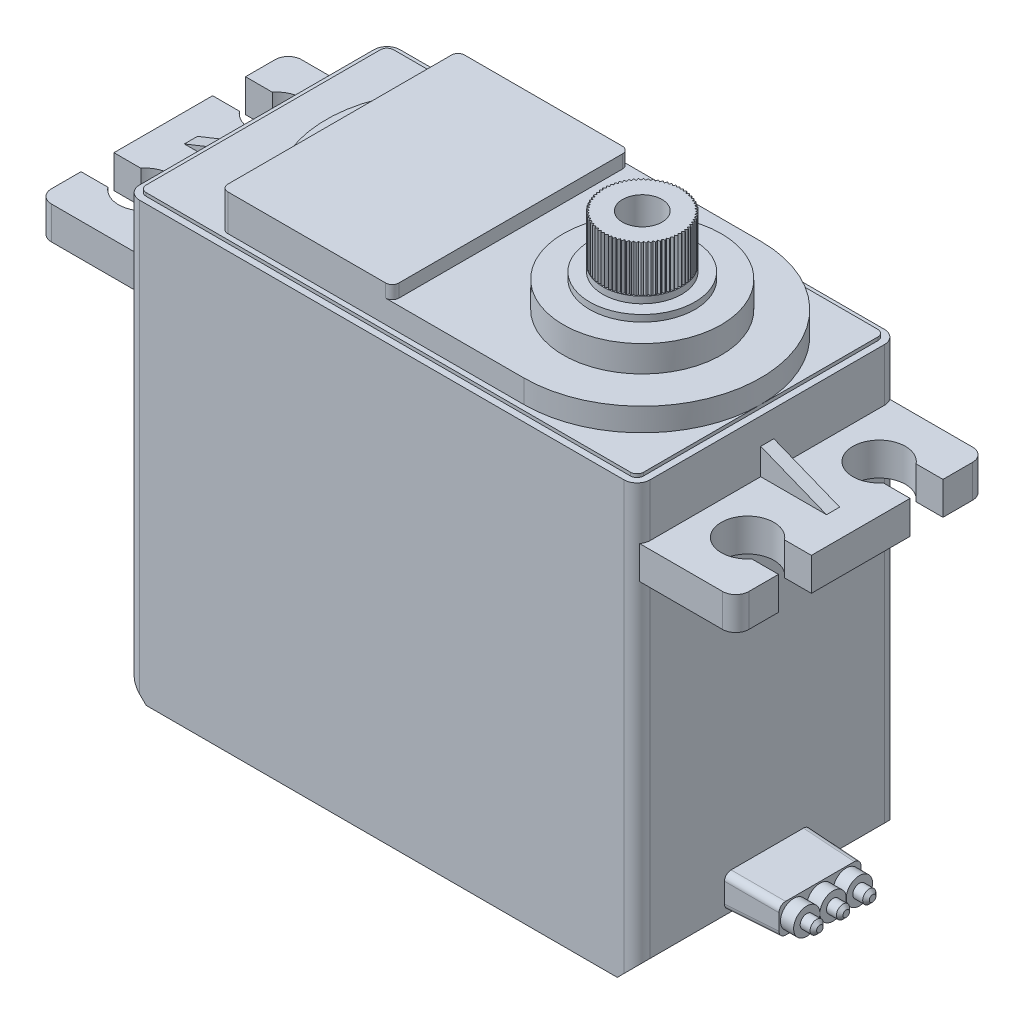
from build123d import *

# Parameters (mm, degrees)
SKETCH1_W          = 38.8
SKETCH1_H          = 19.8
EXTRUDE1_DEPTH     = 26.5
CHAMFER1_SIZE      = 1.5
EXTRUDE5_DEPTH     = 2.5
SKETCH3_W          = 38.8
SKETCH3_H          = 19.8
EXTRUDE6_DEPTH     = 4
FILLET1_R          = 1
EXTRUDE8_DEPTH     = 2
EXTRUDE9_DEPTH     = 1
EXTRUDE10_DEPTH    = 2.5
EXTRUDE11_DEPTH    = 0.25
SKETCH9_R          = 6
EXTRUDE12_DEPTH    = 2
SKETCH10_R         = 4
EXTRUDE13_DEPTH    = 0.5
SKETCH11_R         = 3
EXTRUDE14_DEPTH    = 4
SKETCH22_R         = 1
SKETCH22_R_2       = 0.5
EXTRUDE25_DEPTH    = 5
EXTRUDE25_2_DEPTH  = 5
EXTRUDE25_3_DEPTH  = 5
SKETCH24_R         = 0.5
EXTRUDE26_DEPTH    = 6
CHAMFER2_SIZE      = 0.25
SKETCH25_W         = 6.5
SKETCH25_H         = 2.5
EXTRUDE27_DEPTH    = 4
EXTRUDE27_TAPER    = 2
FILLET8_R          = 0.5
RIB2_REACH         = 52.225
SKETCH28_WALL_W    = 107.834355944
SKETCH28_WALL_H    = 1
CUT_EXTRUDE1_DEPTH = 3.5


with BuildPart() as part:
    # Sketch1 → Extrude1 (new body)
    with BuildSketch(Plane(origin=(0, 0, 0), x_dir=(1, 0, 0), z_dir=(0, 1, 0))):
        Rectangle(SKETCH1_W, SKETCH1_H)
    extrude(amount=EXTRUDE1_DEPTH)

    # Chamfer1
    chamfer1_edges = [part.edges().sort_by_distance(p)[0] for p in [
        (19.4, 0, 0),
        (-19.4, 0, 0),
    ]]
    chamfer(chamfer1_edges, length=CHAMFER1_SIZE)

    # Sketch2 → Extrude5 (add)
    with BuildSketch(Plane(origin=(0, 26.5, 0), x_dir=(-1, 0, 0), z_dir=(0, 1, 0))):
        with BuildLine():
            Line((19.4, -9.9), (-19.4, -9.9))
            Line((-19.4, -9.9), (-19.4, -9.5))
            Line((-19.4, -9.5), (-25.5, -9.5))
            ThreePointArc((-25.5, -9.5), (-26.207106781, -9.207106781), (-26.5, -8.5))
            Line((-26.5, -8.5), (-26.5, -6.25))
            Line((-26.5, -6.25), (-24.4612495, -6.25))
            ThreePointArc((-24.4612495, -6.25), (-20.9, -5), (-24.4612495, -3.75))
            Line((-24.4612495, -3.75), (-26.5, -3.75))
            Line((-26.5, -3.75), (-26.5, 3.75))
            Line((-26.5, 3.75), (-24.4612495, 3.75))
            ThreePointArc((-24.4612495, 3.75), (-20.9, 5), (-24.4612495, 6.25))
            Line((-24.4612495, 6.25), (-26.5, 6.25))
            Line((-26.5, 6.25), (-26.5, 8.5))
            ThreePointArc((-26.5, 8.5), (-26.207106781, 9.207106781), (-25.5, 9.5))
            Line((-25.5, 9.5), (-19.4, 9.5))
            Line((-19.4, 9.5), (-19.4, 9.9))
            Line((-19.4, 9.9), (19.4, 9.9))
            Line((19.4, 9.9), (19.4, 9.5))
            Line((19.4, 9.5), (25.5, 9.5))
            ThreePointArc((25.5, 9.5), (26.207106781, 9.207106781), (26.5, 8.5))
            Line((26.5, 8.5), (26.5, 6.25))
            Line((26.5, 6.25), (24.4612495, 6.25))
            ThreePointArc((24.4612495, 6.25), (20.9, 5), (24.4612495, 3.75))
            Line((24.4612495, 3.75), (26.5, 3.75))
            Line((26.5, 3.75), (26.5, -3.75))
            Line((26.5, -3.75), (24.4612495, -3.75))
            ThreePointArc((24.4612495, -3.75), (20.9, -5), (24.4612495, -6.25))
            Line((24.4612495, -6.25), (26.5, -6.25))
            Line((26.5, -6.25), (26.5, -8.5))
            ThreePointArc((26.5, -8.5), (26.207106781, -9.207106781), (25.5, -9.5))
            Line((25.5, -9.5), (19.4, -9.5))
            Line((19.4, -9.5), (19.4, -9.9))
        make_face()
    extrude(amount=EXTRUDE5_DEPTH)

    # Sketch3 → Extrude6 (add)
    with BuildSketch(Plane(origin=(0, 29, 0), x_dir=(-1, 0, 0), z_dir=(0, 1, 0))):
        Rectangle(SKETCH3_W, SKETCH3_H)
    extrude(amount=EXTRUDE6_DEPTH)

    # Fillet1
    # the kernel refuses this fillet: 1 mm, written as the material it takes off along each edge
    with BuildSketch(Plane(origin=(-19.4, 35.5, -9.9), x_dir=(0, 0, 1), z_dir=(0, -1, 0))) as fillet1_piece_1_section:
        with BuildLine():
            CenterArc((FILLET1_R, -FILLET1_R), FILLET1_R, 90, 90)
            Line((0, -FILLET1_R), (0, 0))
            Line((0, 0), (FILLET1_R, 0))
        make_face()
    fillet1_piece_1 = extrude(amount=36.5, mode=Mode.PRIVATE)
    fillet1_piece_1 = split(fillet1_piece_1, bisect_by=Plane(origin=(-19.357622506, 32.25, -9.5), z_dir=(0, 0, 1)), keep=Keep.TOP, mode=Mode.PRIVATE)
    fillet1_piece_1 = split(fillet1_piece_1, bisect_by=Plane(origin=(-19.357622506, 29, -9.316588344), z_dir=(0, 1, 0)), keep=Keep.TOP, mode=Mode.PRIVATE)
    add(fillet1_piece_1, mode=Mode.SUBTRACT)
    with BuildSketch(Plane(origin=(-19.4, 35.5, -9.9), x_dir=(0, 0, 1), z_dir=(0, -1, 0))) as fillet1_piece_2_section:
        with BuildLine():
            CenterArc((FILLET1_R, -FILLET1_R), FILLET1_R, 90, 90)
            Line((0, -FILLET1_R), (0, 0))
            Line((0, 0), (FILLET1_R, 0))
        make_face()
    fillet1_piece_2 = extrude(amount=36.5, mode=Mode.PRIVATE)
    fillet1_piece_2 = split(fillet1_piece_2, bisect_by=Plane(origin=(-19.128444078, 32.25, -9.5), z_dir=(0, 0, -1)), keep=Keep.TOP, mode=Mode.PRIVATE)
    fillet1_piece_2 = split(fillet1_piece_2, bisect_by=Plane(origin=(-19.128444078, 29, -9.76122234), z_dir=(0, 1, 0)), keep=Keep.TOP, mode=Mode.PRIVATE)
    add(fillet1_piece_2, mode=Mode.SUBTRACT)
    with BuildSketch(Plane(origin=(-19.4, 35.5, -9.9), x_dir=(0, 0, 1), z_dir=(0, -1, 0))) as fillet1_piece_3_section:
        with BuildLine():
            CenterArc((FILLET1_R, -FILLET1_R), FILLET1_R, 90, 90)
            Line((0, -FILLET1_R), (0, 0))
            Line((0, 0), (FILLET1_R, 0))
        make_face()
    fillet1_piece_3 = extrude(amount=36.5, mode=Mode.PRIVATE)
    fillet1_piece_3 = split(fillet1_piece_3, bisect_by=Plane(origin=(-19.128444078, 27.75, -9.5), z_dir=(0, 0, -1)), keep=Keep.TOP, mode=Mode.PRIVATE)
    fillet1_piece_3 = split(fillet1_piece_3, bisect_by=Plane(origin=(-19.128444078, 26.5, -9.76122234), z_dir=(0, 1, 0)), keep=Keep.TOP, mode=Mode.PRIVATE)
    fillet1_piece_3 = split(fillet1_piece_3, bisect_by=Plane(origin=(-19.128444078, 29, -9.76122234), z_dir=(0, -1, 0)), keep=Keep.TOP, mode=Mode.PRIVATE)
    add(fillet1_piece_3, mode=Mode.SUBTRACT)
    with BuildSketch(Plane(origin=(-19.4, 35.5, -9.9), x_dir=(0, 0, 1), z_dir=(0, -1, 0))) as fillet1_piece_4_section:
        with BuildLine():
            CenterArc((FILLET1_R, -FILLET1_R), FILLET1_R, 90, 90)
            Line((0, -FILLET1_R), (0, 0))
            Line((0, 0), (FILLET1_R, 0))
        make_face()
    fillet1_piece_4 = extrude(amount=36.5, mode=Mode.PRIVATE)
    fillet1_piece_4 = split(fillet1_piece_4, bisect_by=Plane(origin=(-19.357622506, 12.75, -9.5), z_dir=(0, 0, 1)), keep=Keep.TOP, mode=Mode.PRIVATE)
    fillet1_piece_4 = split(fillet1_piece_4, bisect_by=Plane(origin=(-19.357622506, 26.5, -9.316588344), z_dir=(0, -1, 0)), keep=Keep.TOP, mode=Mode.PRIVATE)
    add(fillet1_piece_4, mode=Mode.SUBTRACT)
    with BuildSketch(Plane(origin=(-19.4, 35.5, -9.9), x_dir=(0, 0, 1), z_dir=(0, -1, 0))) as fillet1_piece_5_section:
        with BuildLine():
            CenterArc((FILLET1_R, -FILLET1_R), FILLET1_R, 90, 90)
            Line((0, -FILLET1_R), (0, 0))
            Line((0, 0), (FILLET1_R, 0))
        make_face()
    fillet1_piece_5 = extrude(amount=36.5, mode=Mode.PRIVATE)
    fillet1_piece_5 = split(fillet1_piece_5, bisect_by=Plane(origin=(-19.128444078, 12.75, -9.5), z_dir=(0, 0, -1)), keep=Keep.TOP, mode=Mode.PRIVATE)
    fillet1_piece_5 = split(fillet1_piece_5, bisect_by=Plane(origin=(-19.128444078, 26.5, -9.76122234), z_dir=(0, -1, 0)), keep=Keep.TOP, mode=Mode.PRIVATE)
    add(fillet1_piece_5, mode=Mode.SUBTRACT)
    with BuildSketch(Plane(origin=(19.4, 35.5, -9.9), x_dir=(0, 0, 1), z_dir=(0, -1, 0))) as fillet1_piece_6_section:
        with BuildLine():
            CenterArc((FILLET1_R, FILLET1_R), FILLET1_R, 180, 90)
            Line((0, FILLET1_R), (0, 0))
            Line((0, 0), (FILLET1_R, 0))
        make_face()
    fillet1_piece_6 = extrude(amount=36.5, mode=Mode.PRIVATE)
    fillet1_piece_6 = split(fillet1_piece_6, bisect_by=Plane(origin=(19.357622506, 32.25, -9.5), z_dir=(0, 0, 1)), keep=Keep.TOP, mode=Mode.PRIVATE)
    fillet1_piece_6 = split(fillet1_piece_6, bisect_by=Plane(origin=(19.357622506, 29, -9.316588344), z_dir=(0, 1, 0)), keep=Keep.TOP, mode=Mode.PRIVATE)
    add(fillet1_piece_6, mode=Mode.SUBTRACT)
    with BuildSketch(Plane(origin=(19.4, 35.5, -9.9), x_dir=(0, 0, 1), z_dir=(0, -1, 0))) as fillet1_piece_7_section:
        with BuildLine():
            CenterArc((FILLET1_R, FILLET1_R), FILLET1_R, 180, 90)
            Line((0, FILLET1_R), (0, 0))
            Line((0, 0), (FILLET1_R, 0))
        make_face()
    fillet1_piece_7 = extrude(amount=36.5, mode=Mode.PRIVATE)
    fillet1_piece_7 = split(fillet1_piece_7, bisect_by=Plane(origin=(19.128444078, 32.25, -9.5), z_dir=(0, 0, -1)), keep=Keep.TOP, mode=Mode.PRIVATE)
    fillet1_piece_7 = split(fillet1_piece_7, bisect_by=Plane(origin=(19.128444078, 29, -9.76122234), z_dir=(0, 1, 0)), keep=Keep.TOP, mode=Mode.PRIVATE)
    add(fillet1_piece_7, mode=Mode.SUBTRACT)
    with BuildSketch(Plane(origin=(19.4, 35.5, -9.9), x_dir=(0, 0, 1), z_dir=(0, -1, 0))) as fillet1_piece_8_section:
        with BuildLine():
            CenterArc((FILLET1_R, FILLET1_R), FILLET1_R, 180, 90)
            Line((0, FILLET1_R), (0, 0))
            Line((0, 0), (FILLET1_R, 0))
        make_face()
    fillet1_piece_8 = extrude(amount=36.5, mode=Mode.PRIVATE)
    fillet1_piece_8 = split(fillet1_piece_8, bisect_by=Plane(origin=(19.128444078, 26.5, -9.76122234), z_dir=(0, 1, 0)), keep=Keep.TOP, mode=Mode.PRIVATE)
    fillet1_piece_8 = split(fillet1_piece_8, bisect_by=Plane(origin=(19.128444078, 27.75, -9.5), z_dir=(0, 0, -1)), keep=Keep.TOP, mode=Mode.PRIVATE)
    fillet1_piece_8 = split(fillet1_piece_8, bisect_by=Plane(origin=(19.128444078, 29, -9.76122234), z_dir=(0, -1, 0)), keep=Keep.TOP, mode=Mode.PRIVATE)
    add(fillet1_piece_8, mode=Mode.SUBTRACT)
    with BuildSketch(Plane(origin=(19.4, 35.5, -9.9), x_dir=(0, 0, 1), z_dir=(0, -1, 0))) as fillet1_piece_9_section:
        with BuildLine():
            CenterArc((FILLET1_R, FILLET1_R), FILLET1_R, 180, 90)
            Line((0, FILLET1_R), (0, 0))
            Line((0, 0), (FILLET1_R, 0))
        make_face()
    fillet1_piece_9 = extrude(amount=36.5, mode=Mode.PRIVATE)
    fillet1_piece_9 = split(fillet1_piece_9, bisect_by=Plane(origin=(19.357622506, 26.5, -9.316588344), z_dir=(0, -1, 0)), keep=Keep.TOP, mode=Mode.PRIVATE)
    fillet1_piece_9 = split(fillet1_piece_9, bisect_by=Plane(origin=(19.357622506, 12.75, -9.5), z_dir=(0, 0, 1)), keep=Keep.TOP, mode=Mode.PRIVATE)
    add(fillet1_piece_9, mode=Mode.SUBTRACT)
    with BuildSketch(Plane(origin=(19.4, 35.5, -9.9), x_dir=(0, 0, 1), z_dir=(0, -1, 0))) as fillet1_piece_10_section:
        with BuildLine():
            CenterArc((FILLET1_R, FILLET1_R), FILLET1_R, 180, 90)
            Line((0, FILLET1_R), (0, 0))
            Line((0, 0), (FILLET1_R, 0))
        make_face()
    fillet1_piece_10 = extrude(amount=36.5, mode=Mode.PRIVATE)
    fillet1_piece_10 = split(fillet1_piece_10, bisect_by=Plane(origin=(19.128444078, 26.5, -9.76122234), z_dir=(0, -1, 0)), keep=Keep.TOP, mode=Mode.PRIVATE)
    fillet1_piece_10 = split(fillet1_piece_10, bisect_by=Plane(origin=(19.128444078, 12.75, -9.5), z_dir=(0, 0, -1)), keep=Keep.TOP, mode=Mode.PRIVATE)
    add(fillet1_piece_10, mode=Mode.SUBTRACT)
    with BuildSketch(Plane(origin=(-19.4, -1, 9.9), x_dir=(0, 0, -1), z_dir=(0, 1, 0))) as fillet1_piece_11_section:
        with BuildLine():
            CenterArc((FILLET1_R, -FILLET1_R), FILLET1_R, 90, 90)
            Line((0, -FILLET1_R), (0, 0))
            Line((0, 0), (FILLET1_R, 0))
        make_face()
    fillet1_piece_11 = extrude(amount=36.5, mode=Mode.PRIVATE)
    fillet1_piece_11 = split(fillet1_piece_11, bisect_by=Plane(origin=(-19.357622506, 26.5, 9.316588344), z_dir=(0, -1, 0)), keep=Keep.TOP, mode=Mode.PRIVATE)
    fillet1_piece_11 = split(fillet1_piece_11, bisect_by=Plane(origin=(-19.357622506, 12.75, 9.5), z_dir=(0, 0, -1)), keep=Keep.TOP, mode=Mode.PRIVATE)
    add(fillet1_piece_11, mode=Mode.SUBTRACT)
    with BuildSketch(Plane(origin=(-19.4, -1, 9.9), x_dir=(0, 0, -1), z_dir=(0, 1, 0))) as fillet1_piece_12_section:
        with BuildLine():
            CenterArc((FILLET1_R, -FILLET1_R), FILLET1_R, 90, 90)
            Line((0, -FILLET1_R), (0, 0))
            Line((0, 0), (FILLET1_R, 0))
        make_face()
    fillet1_piece_12 = extrude(amount=36.5, mode=Mode.PRIVATE)
    fillet1_piece_12 = split(fillet1_piece_12, bisect_by=Plane(origin=(-19.128444078, 26.5, 9.76122234), z_dir=(0, -1, 0)), keep=Keep.TOP, mode=Mode.PRIVATE)
    fillet1_piece_12 = split(fillet1_piece_12, bisect_by=Plane(origin=(-19.128444078, 12.75, 9.5), z_dir=(0, 0, 1)), keep=Keep.TOP, mode=Mode.PRIVATE)
    add(fillet1_piece_12, mode=Mode.SUBTRACT)
    with BuildSketch(Plane(origin=(-19.4, -1, 9.9), x_dir=(0, 0, -1), z_dir=(0, 1, 0))) as fillet1_piece_13_section:
        with BuildLine():
            CenterArc((FILLET1_R, -FILLET1_R), FILLET1_R, 90, 90)
            Line((0, -FILLET1_R), (0, 0))
            Line((0, 0), (FILLET1_R, 0))
        make_face()
    fillet1_piece_13 = extrude(amount=36.5, mode=Mode.PRIVATE)
    fillet1_piece_13 = split(fillet1_piece_13, bisect_by=Plane(origin=(-19.128444078, 26.5, 9.76122234), z_dir=(0, 1, 0)), keep=Keep.TOP, mode=Mode.PRIVATE)
    fillet1_piece_13 = split(fillet1_piece_13, bisect_by=Plane(origin=(-19.128444078, 27.75, 9.5), z_dir=(0, 0, 1)), keep=Keep.TOP, mode=Mode.PRIVATE)
    fillet1_piece_13 = split(fillet1_piece_13, bisect_by=Plane(origin=(-19.128444078, 29, 9.76122234), z_dir=(0, -1, 0)), keep=Keep.TOP, mode=Mode.PRIVATE)
    add(fillet1_piece_13, mode=Mode.SUBTRACT)
    with BuildSketch(Plane(origin=(-19.4, -1, 9.9), x_dir=(0, 0, -1), z_dir=(0, 1, 0))) as fillet1_piece_14_section:
        with BuildLine():
            CenterArc((FILLET1_R, -FILLET1_R), FILLET1_R, 90, 90)
            Line((0, -FILLET1_R), (0, 0))
            Line((0, 0), (FILLET1_R, 0))
        make_face()
    fillet1_piece_14 = extrude(amount=36.5, mode=Mode.PRIVATE)
    fillet1_piece_14 = split(fillet1_piece_14, bisect_by=Plane(origin=(-19.357622506, 32.25, 9.5), z_dir=(0, 0, -1)), keep=Keep.TOP, mode=Mode.PRIVATE)
    fillet1_piece_14 = split(fillet1_piece_14, bisect_by=Plane(origin=(-19.357622506, 29, 9.316588344), z_dir=(0, 1, 0)), keep=Keep.TOP, mode=Mode.PRIVATE)
    add(fillet1_piece_14, mode=Mode.SUBTRACT)
    with BuildSketch(Plane(origin=(-19.4, -1, 9.9), x_dir=(0, 0, -1), z_dir=(0, 1, 0))) as fillet1_piece_15_section:
        with BuildLine():
            CenterArc((FILLET1_R, -FILLET1_R), FILLET1_R, 90, 90)
            Line((0, -FILLET1_R), (0, 0))
            Line((0, 0), (FILLET1_R, 0))
        make_face()
    fillet1_piece_15 = extrude(amount=36.5, mode=Mode.PRIVATE)
    fillet1_piece_15 = split(fillet1_piece_15, bisect_by=Plane(origin=(-19.128444078, 32.25, 9.5), z_dir=(0, 0, 1)), keep=Keep.TOP, mode=Mode.PRIVATE)
    fillet1_piece_15 = split(fillet1_piece_15, bisect_by=Plane(origin=(-19.128444078, 29, 9.76122234), z_dir=(0, 1, 0)), keep=Keep.TOP, mode=Mode.PRIVATE)
    add(fillet1_piece_15, mode=Mode.SUBTRACT)
    with BuildSketch(Plane(origin=(19.4, -1, 9.9), x_dir=(0, 0, -1), z_dir=(0, 1, 0))) as fillet1_piece_16_section:
        with BuildLine():
            CenterArc((FILLET1_R, FILLET1_R), FILLET1_R, 180, 90)
            Line((0, FILLET1_R), (0, 0))
            Line((0, 0), (FILLET1_R, 0))
        make_face()
    fillet1_piece_16 = extrude(amount=36.5, mode=Mode.PRIVATE)
    fillet1_piece_16 = split(fillet1_piece_16, bisect_by=Plane(origin=(19.357622506, 12.75, 9.5), z_dir=(0, 0, -1)), keep=Keep.TOP, mode=Mode.PRIVATE)
    fillet1_piece_16 = split(fillet1_piece_16, bisect_by=Plane(origin=(19.357622506, 26.5, 9.316588344), z_dir=(0, -1, 0)), keep=Keep.TOP, mode=Mode.PRIVATE)
    add(fillet1_piece_16, mode=Mode.SUBTRACT)
    with BuildSketch(Plane(origin=(19.4, -1, 9.9), x_dir=(0, 0, -1), z_dir=(0, 1, 0))) as fillet1_piece_17_section:
        with BuildLine():
            CenterArc((FILLET1_R, FILLET1_R), FILLET1_R, 180, 90)
            Line((0, FILLET1_R), (0, 0))
            Line((0, 0), (FILLET1_R, 0))
        make_face()
    fillet1_piece_17 = extrude(amount=36.5, mode=Mode.PRIVATE)
    fillet1_piece_17 = split(fillet1_piece_17, bisect_by=Plane(origin=(19.128444078, 12.75, 9.5), z_dir=(0, 0, 1)), keep=Keep.TOP, mode=Mode.PRIVATE)
    fillet1_piece_17 = split(fillet1_piece_17, bisect_by=Plane(origin=(19.128444078, 26.5, 9.76122234), z_dir=(0, -1, 0)), keep=Keep.TOP, mode=Mode.PRIVATE)
    add(fillet1_piece_17, mode=Mode.SUBTRACT)
    with BuildSketch(Plane(origin=(19.4, -1, 9.9), x_dir=(0, 0, -1), z_dir=(0, 1, 0))) as fillet1_piece_18_section:
        with BuildLine():
            CenterArc((FILLET1_R, FILLET1_R), FILLET1_R, 180, 90)
            Line((0, FILLET1_R), (0, 0))
            Line((0, 0), (FILLET1_R, 0))
        make_face()
    fillet1_piece_18 = extrude(amount=36.5, mode=Mode.PRIVATE)
    fillet1_piece_18 = split(fillet1_piece_18, bisect_by=Plane(origin=(19.128444078, 27.75, 9.5), z_dir=(0, 0, 1)), keep=Keep.TOP, mode=Mode.PRIVATE)
    fillet1_piece_18 = split(fillet1_piece_18, bisect_by=Plane(origin=(19.128444078, 26.5, 9.76122234), z_dir=(0, 1, 0)), keep=Keep.TOP, mode=Mode.PRIVATE)
    fillet1_piece_18 = split(fillet1_piece_18, bisect_by=Plane(origin=(19.128444078, 29, 9.76122234), z_dir=(0, -1, 0)), keep=Keep.TOP, mode=Mode.PRIVATE)
    add(fillet1_piece_18, mode=Mode.SUBTRACT)
    with BuildSketch(Plane(origin=(19.4, -1, 9.9), x_dir=(0, 0, -1), z_dir=(0, 1, 0))) as fillet1_piece_19_section:
        with BuildLine():
            CenterArc((FILLET1_R, FILLET1_R), FILLET1_R, 180, 90)
            Line((0, FILLET1_R), (0, 0))
            Line((0, 0), (FILLET1_R, 0))
        make_face()
    fillet1_piece_19 = extrude(amount=36.5, mode=Mode.PRIVATE)
    fillet1_piece_19 = split(fillet1_piece_19, bisect_by=Plane(origin=(19.357622506, 32.25, 9.5), z_dir=(0, 0, -1)), keep=Keep.TOP, mode=Mode.PRIVATE)
    fillet1_piece_19 = split(fillet1_piece_19, bisect_by=Plane(origin=(19.357622506, 29, 9.316588344), z_dir=(0, 1, 0)), keep=Keep.TOP, mode=Mode.PRIVATE)
    add(fillet1_piece_19, mode=Mode.SUBTRACT)
    with BuildSketch(Plane(origin=(19.4, -1, 9.9), x_dir=(0, 0, -1), z_dir=(0, 1, 0))) as fillet1_piece_20_section:
        with BuildLine():
            CenterArc((FILLET1_R, FILLET1_R), FILLET1_R, 180, 90)
            Line((0, FILLET1_R), (0, 0))
            Line((0, 0), (FILLET1_R, 0))
        make_face()
    fillet1_piece_20 = extrude(amount=36.5, mode=Mode.PRIVATE)
    fillet1_piece_20 = split(fillet1_piece_20, bisect_by=Plane(origin=(19.128444078, 32.25, 9.5), z_dir=(0, 0, 1)), keep=Keep.TOP, mode=Mode.PRIVATE)
    fillet1_piece_20 = split(fillet1_piece_20, bisect_by=Plane(origin=(19.128444078, 29, 9.76122234), z_dir=(0, 1, 0)), keep=Keep.TOP, mode=Mode.PRIVATE)
    add(fillet1_piece_20, mode=Mode.SUBTRACT)

    # Sketch5 → Extrude8 (add)
    with BuildSketch(Plane(origin=(0, 33, 0), x_dir=(-1, 0, 0), z_dir=(0, 1, 0))):
        with BuildLine():
            Line((13.1, -8.5), (13.1, 8.5))
            ThreePointArc((13.1, 8.5), (12.953553391, 8.853553391), (12.6, 9))
            Line((12.6, 9), (-9.9, 9))
            ThreePointArc((-9.9, 9), (-18.9, 0), (-9.9, -9))
            Line((-9.9, -9), (12.6, -9))
            ThreePointArc((12.6, -9), (12.953553391, -8.853553391), (13.1, -8.5))
        make_face()
    extrude(amount=EXTRUDE8_DEPTH)

    # Sketch6 → Extrude9 (add)
    with BuildSketch(Plane(origin=(0, 35, 0), x_dir=(-1, 0, 0), z_dir=(0, 1, 0))):
        with BuildLine():
            Line((0.6, -9), (12.6, -9))
            ThreePointArc((12.6, -9), (12.953553391, -8.853553391), (13.1, -8.5))
            Line((13.1, -8.5), (13.1, 8.5))
            ThreePointArc((13.1, 8.5), (12.953553391, 8.853553391), (12.6, 9))
            Line((12.6, 9), (0.6, 9))
            ThreePointArc((0.6, 9), (0.246446609, 8.853553391), (0.1, 8.5))
            Line((0.1, 8.5), (0.1, -8.5))
            ThreePointArc((0.1, -8.5), (0.246446609, -8.853553391), (0.6, -9))
        make_face()
    extrude(amount=EXTRUDE9_DEPTH)

    # Sketch7 → Extrude10 (add)
    with BuildSketch(Plane(origin=(0, 33, 0), x_dir=(-1, 0, 0), z_dir=(0, 1, 0))):
        with BuildLine():
            Line((12.6, -5), (12.6, 5))
            ThreePointArc((12.6, 5), (14.116685226, 0), (12.6, -5))
        make_face()
    extrude(amount=EXTRUDE10_DEPTH)

    # Sketch8 → Extrude11 (add)
    with BuildSketch(Plane(origin=(0, 33, 0), x_dir=(-1, 0, 0), z_dir=(0, 1, 0))):
        with BuildLine():
            Line((18.9, -8.9), (18.9, 8.9))
            ThreePointArc((18.9, 8.9), (18.753553391, 9.253553391), (18.4, 9.4))
            Line((18.4, 9.4), (-18.4, 9.4))
            ThreePointArc((-18.4, 9.4), (-18.753553391, 9.253553391), (-18.9, 8.9))
            Line((-18.9, 8.9), (-18.9, -8.9))
            ThreePointArc((-18.9, -8.9), (-18.753553391, -9.253553391), (-18.4, -9.4))
            Line((-18.4, -9.4), (18.4, -9.4))
            ThreePointArc((18.4, -9.4), (18.753553391, -9.253553391), (18.9, -8.9))
        make_face()
    extrude(amount=EXTRUDE11_DEPTH)

    # Sketch9 → Extrude12 (add)
    with BuildSketch(Plane(origin=(0, 35, 0), x_dir=(-1, 0, 0), z_dir=(0, 1, 0))):
        with Locations(Location((-9.9, 0, 0), (0, 0, 270))):
            Circle(SKETCH9_R)
    extrude(amount=EXTRUDE12_DEPTH)

    # Sketch10 → Extrude13 (add)
    with BuildSketch(Plane(origin=(0, 37, 0), x_dir=(-1, 0, 0), z_dir=(0, 1, 0))):
        with Locations(Location((-9.9, 0, 0), (0, 0, 90))):
            Circle(SKETCH10_R)
    extrude(amount=EXTRUDE13_DEPTH)

    # Sketch24 → Extrude26 (add)
    with BuildSketch(Plane(origin=(19.4, 0, 0), x_dir=(0, 0, -1), z_dir=(1, 0, 0))):
        with Locations((-2, 3)):
            Circle(SKETCH24_R)
        with Locations((0, 3)):
            Circle(SKETCH24_R)
        with Locations((2, 3)):
            Circle(SKETCH24_R)
    extrude(amount=EXTRUDE26_DEPTH)

    # Chamfer2
    chamfer2_edges = [part.edges().sort_by_distance(p)[0] for p in [
        (25.4, 3, 2.5),
        (25.4, 3, 0.5),
        (25.4, 3, -1.5),
    ]]
    chamfer(chamfer2_edges, length=CHAMFER2_SIZE)

    # Sketch28 wall → Rib2 (add, up to next)
    with BuildSketch(Plane(origin=(-21.9, 30, 0), x_dir=(0.928476690885, 0.371390676354, 0), z_dir=(-0.371390676354, 0.928476690885, 0)), mode=Mode.PRIVATE) as rib2_sk1:
        Rectangle(SKETCH28_WALL_W, SKETCH28_WALL_H)
    rib2_tool1 = extrude(rib2_sk1.sketch, amount=-RIB2_REACH, mode=Mode.PRIVATE) - part.part
    rib2 = rib2_tool1.solids().sort_by_distance((-21.9, 30, 0))[0]
    add(rib2)

    # Mirror1: Rib2 across plane
    add(rib2.mirror(Plane(origin=(0, 0, 0), x_dir=(0, 0, 1), z_dir=(1, 0, 0))))


with BuildPart() as body_2:
    # Sketch11 → Extrude14 (new body)
    with BuildSketch(Plane(origin=(0, 37.5, 0), x_dir=(-1, 0, 0), z_dir=(0, 1, 0))):
        with Locations(Location((-9.9, 0, 0), (0, 0, 90))):
            Circle(SKETCH11_R)
    extrude(amount=EXTRUDE14_DEPTH)

    # Sketch26 → Ø3.0 (3) Diameter Hole1 (revolve, cut)
    with BuildSketch(Plane(origin=(9.9, 41.5, 0), x_dir=(0, 0, 1), z_dir=(1, 0, 0))):
        Polygon((0, 0), (0, 5.901290929), (1.5, 5), (1.5, 0), align=None)
    revolve(axis=Axis((9.9, 47.85, 0), (0, -1, 0)), mode=Mode.SUBTRACT)

    # Sketch30 → Cut-Extrude1 (cut)
    with BuildSketch(Plane(origin=(0, 41.5, 0), x_dir=(1, 0, 0), z_dir=(0, 1, 0))):
        with BuildLine():
            Line((9.775, 2.997394702), (9.9, 2.85))
            Line((9.9, 2.85), (10.025, 2.997394702))
            ThreePointArc((10.025, 2.997394702), (9.9, 3), (9.775, 2.997394702))
        make_face()
        with BuildLine():
            Line((10.15547203, 2.838526738), (10.293181176, 2.974123159))
            ThreePointArc((10.293181176, 2.974123159), (10.168917927, 2.987922882), (10.044187603, 2.996532986))
            Line((10.044187603, 2.996532986), (10.15547203, 2.838526738))
        make_face()
        with BuildLine():
            Line((10.40888715, 2.804199328), (10.558196689, 2.926905724))
            ThreePointArc((10.558196689, 2.926905724), (10.435670684, 2.951788766), (10.312214292, 2.971544948))
            Line((10.312214292, 2.971544948), (10.40888715, 2.804199328))
        make_face()
        with BuildLine():
            Line((10.65820501, 2.747294153), (10.817912789, 2.856122566))
            ThreePointArc((10.817912789, 2.856122566), (10.698110537, 2.891888582), (10.576922074, 2.922631777))
            Line((10.576922074, 2.922631777), (10.65820501, 2.747294153))
        make_face()
        with BuildLine():
            Line((10.901418249, 2.668269381), (11.070238395, 2.762343588))
            ThreePointArc((11.070238395, 2.762343588), (10.954124472, 2.808704612), (10.836179677, 2.850187294))
            Line((10.836179677, 2.850187294), (10.901418249, 2.668269381))
        make_face()
        with BuildLine():
            Line((11.136568656, 2.567761274), (11.313141929, 2.646323844))
            ThreePointArc((11.313141929, 2.646323844), (11.201651217, 2.702906604), (11.087899712, 2.754794779))
            Line((11.087899712, 2.754794779), (11.136568656, 2.567761274))
        make_face()
        with BuildLine():
            Line((11.361762941, 2.446579062), (11.544667676, 2.508997456))
            ThreePointArc((11.544667676, 2.508997456), (11.438697832, 2.575346381), (11.330055478, 2.637222276))
            Line((11.330055478, 2.637222276), (11.361762941, 2.446579062))
        make_face()
        with BuildLine():
            Line((11.575187969, 2.305698434), (11.762951525, 2.351470096))
            ThreePointArc((11.762951525, 2.351470096), (11.663355757, 2.427050983), (11.560697277, 2.498416409))
            Line((11.560697277, 2.498416409), (11.575187969, 2.305698434))
        make_face()
        with BuildLine():
            Line((11.775125369, 2.146253678), (11.966235985, 2.175010082))
            ThreePointArc((11.966235985, 2.175010082), (11.873816178, 2.259214398), (11.777968118, 2.339494763))
            Line((11.777968118, 2.339494763), (11.775125369, 2.146253678))
        make_face()
        with BuildLine():
            Line((11.959965362, 1.96952855), (12.152884327, 1.981038165))
            ThreePointArc((12.152884327, 1.981038165), (12.068384591, 2.073187947), (11.980118664, 2.161736881))
            Line((11.980118664, 2.161736881), (11.959965362, 1.96952855))
        make_face()
        with BuildLine():
            Line((12.128219725, 1.776945935), (12.321393769, 1.771116094))
            ThreePointArc((12.321393769, 1.771116094), (12.245494447, 1.870469406), (12.165521318, 1.966573964))
            Line((12.165521318, 1.966573964), (12.128219725, 1.776945935))
        make_face()
        with BuildLine():
            Line((12.278533773, 1.570056397), (12.470407572, 1.546934037))
            ThreePointArc((12.470407572, 1.546934037), (12.403719761, 1.652690944), (12.332683327, 1.75557735))
            Line((12.332683327, 1.75557735), (12.278533773, 1.570056397))
        make_face()
        with BuildLine():
            Line((12.409697266, 1.350525688), (12.598725965, 1.310296977))
            ThreePointArc((12.598725965, 1.310296977), (12.541786596, 1.421605987), (12.480258799, 1.53044586))
            Line((12.480258799, 1.53044586), (12.409697266, 1.350525688))
        make_face()
        with BuildLine():
            Line((12.520654152, 1.12012134), (12.705315803, 1.063110176))
            ThreePointArc((12.705315803, 1.063110176), (12.658583318, 1.179075095), (12.607059545, 1.292992119))
            Line((12.607059545, 1.292992119), (12.520654152, 1.12012134))
        make_face()
        with BuildLine():
            Line((12.610511071, 0.880698434), (12.789318888, 0.807363837))
            ThreePointArc((12.789318888, 0.807363837), (12.753169549, 0.927050983), (12.712064639, 1.045127966))
            Line((12.712064639, 1.045127966), (12.610511071, 0.880698434))
        make_face()
        with BuildLine():
            Line((12.67854455, 0.634184662), (12.850058876, 0.54511708))
            ThreePointArc((12.850058876, 0.54511708), (12.824783737, 0.667562802), (12.794428642, 0.788849058))
            Line((12.794428642, 0.788849058), (12.67854455, 0.634184662))
        make_face()
        with BuildLine():
            Line((12.724206821, 0.382564808), (12.887046724, 0.27848136))
            ThreePointArc((12.887046724, 0.27848136), (12.872849285, 0.402699797), (12.853488408, 0.5262188))
            Line((12.853488408, 0.5262188), (12.724206821, 0.382564808))
        make_face()
        with BuildLine():
            Line((12.74713024, 0.127864766), (12.899984629, 0.009603471))
            ThreePointArc((12.899984629, 0.009603471), (12.8969792, 0.134594491), (12.888768421, 0.259351738))
            Line((12.888768421, 0.259351738), (12.74713024, 0.127864766))
        make_face()
        with BuildLine():
            Line((12.74713024, -0.127864766), (12.888768421, -0.259351738))
            ThreePointArc((12.888768421, -0.259351738), (12.8969792, -0.134594491), (12.899984629, -0.009603471))
            Line((12.899984629, -0.009603471), (12.74713024, -0.127864766))
        make_face()
        with BuildLine():
            Line((12.724206821, -0.382564808), (12.853488408, -0.5262188))
            ThreePointArc((12.853488408, -0.5262188), (12.872849285, -0.402699797), (12.887046724, -0.27848136))
            Line((12.887046724, -0.27848136), (12.724206821, -0.382564808))
        make_face()
        with BuildLine():
            Line((12.67854455, -0.634184662), (12.794428642, -0.788849058))
            ThreePointArc((12.794428642, -0.788849058), (12.824783737, -0.667562802), (12.850058876, -0.54511708))
            Line((12.850058876, -0.54511708), (12.67854455, -0.634184662))
        make_face()
        with BuildLine():
            Line((12.610511071, -0.880698434), (12.712064639, -1.045127966))
            ThreePointArc((12.712064639, -1.045127966), (12.753169549, -0.927050983), (12.789318888, -0.807363837))
            Line((12.789318888, -0.807363837), (12.610511071, -0.880698434))
        make_face()
        with BuildLine():
            Line((12.520654152, -1.12012134), (12.607059545, -1.292992119))
            ThreePointArc((12.607059545, -1.292992119), (12.658583318, -1.179075095), (12.705315803, -1.063110176))
            Line((12.705315803, -1.063110176), (12.520654152, -1.12012134))
        make_face()
        with BuildLine():
            Line((12.409697266, -1.350525688), (12.480258799, -1.53044586))
            ThreePointArc((12.480258799, -1.53044586), (12.541786596, -1.421605987), (12.598725965, -1.310296977))
            Line((12.598725965, -1.310296977), (12.409697266, -1.350525688))
        make_face()
        with BuildLine():
            Line((12.278533773, -1.570056397), (12.332683327, -1.75557735))
            ThreePointArc((12.332683327, -1.75557735), (12.403719761, -1.652690944), (12.470407572, -1.546934037))
            Line((12.470407572, -1.546934037), (12.278533773, -1.570056397))
        make_face()
        with BuildLine():
            Line((12.128219725, -1.776945935), (12.165521318, -1.966573964))
            ThreePointArc((12.165521318, -1.966573964), (12.245494447, -1.870469406), (12.321393769, -1.771116094))
            Line((12.321393769, -1.771116094), (12.128219725, -1.776945935))
        make_face()
        with BuildLine():
            Line((11.959965362, -1.96952855), (11.980118664, -2.161736881))
            ThreePointArc((11.980118664, -2.161736881), (12.068384591, -2.073187947), (12.152884327, -1.981038165))
            Line((12.152884327, -1.981038165), (11.959965362, -1.96952855))
        make_face()
        with BuildLine():
            Line((11.775125369, -2.146253678), (11.777968118, -2.339494763))
            ThreePointArc((11.777968118, -2.339494763), (11.873816178, -2.259214398), (11.966235985, -2.175010082))
            Line((11.966235985, -2.175010082), (11.775125369, -2.146253678))
        make_face()
        with BuildLine():
            Line((11.575187969, -2.305698434), (11.560697277, -2.498416409))
            ThreePointArc((11.560697277, -2.498416409), (11.663355757, -2.427050983), (11.762951525, -2.351470096))
            Line((11.762951525, -2.351470096), (11.575187969, -2.305698434))
        make_face()
        with BuildLine():
            Line((11.361762941, -2.446579062), (11.330055478, -2.637222276))
            ThreePointArc((11.330055478, -2.637222276), (11.438697832, -2.575346381), (11.544667676, -2.508997456))
            Line((11.544667676, -2.508997456), (11.361762941, -2.446579062))
        make_face()
        with BuildLine():
            Line((11.136568656, -2.567761274), (11.087899712, -2.754794779))
            ThreePointArc((11.087899712, -2.754794779), (11.201651217, -2.702906604), (11.313141929, -2.646323844))
            Line((11.313141929, -2.646323844), (11.136568656, -2.567761274))
        make_face()
        with BuildLine():
            Line((10.901418249, -2.668269381), (10.836179677, -2.850187294))
            ThreePointArc((10.836179677, -2.850187294), (10.954124472, -2.808704612), (11.070238395, -2.762343588))
            Line((11.070238395, -2.762343588), (10.901418249, -2.668269381))
        make_face()
        with BuildLine():
            Line((10.65820501, -2.747294153), (10.576922074, -2.922631777))
            ThreePointArc((10.576922074, -2.922631777), (10.698110537, -2.891888582), (10.817912789, -2.856122566))
            Line((10.817912789, -2.856122566), (10.65820501, -2.747294153))
        make_face()
        with BuildLine():
            Line((10.40888715, -2.804199328), (10.312214292, -2.971544948))
            ThreePointArc((10.312214292, -2.971544948), (10.435670684, -2.951788766), (10.558196689, -2.926905724))
            Line((10.558196689, -2.926905724), (10.40888715, -2.804199328))
        make_face()
        with BuildLine():
            Line((10.15547203, -2.838526738), (10.044187603, -2.996532986))
            ThreePointArc((10.044187603, -2.996532986), (10.168917927, -2.987922882), (10.293181176, -2.974123159))
            Line((10.293181176, -2.974123159), (10.15547203, -2.838526738))
        make_face()
        with BuildLine():
            Line((9.9, -2.85), (9.775, -2.997394702))
            ThreePointArc((9.775, -2.997394702), (9.9, -3), (10.025, -2.997394702))
            Line((10.025, -2.997394702), (9.9, -2.85))
        make_face()
        with BuildLine():
            Line((9.64452797, -2.838526738), (9.506818824, -2.974123159))
            ThreePointArc((9.506818824, -2.974123159), (9.631082073, -2.987922882), (9.755812397, -2.996532986))
            Line((9.755812397, -2.996532986), (9.64452797, -2.838526738))
        make_face()
        with BuildLine():
            Line((9.39111285, -2.804199328), (9.241803311, -2.926905724))
            ThreePointArc((9.241803311, -2.926905724), (9.364329316, -2.951788766), (9.487785708, -2.971544948))
            Line((9.487785708, -2.971544948), (9.39111285, -2.804199328))
        make_face()
        with BuildLine():
            Line((9.14179499, -2.747294153), (8.982087211, -2.856122566))
            ThreePointArc((8.982087211, -2.856122566), (9.101889463, -2.891888582), (9.223077926, -2.922631777))
            Line((9.223077926, -2.922631777), (9.14179499, -2.747294153))
        make_face()
        with BuildLine():
            Line((8.898581751, -2.668269381), (8.729761605, -2.762343588))
            ThreePointArc((8.729761605, -2.762343588), (8.845875528, -2.808704612), (8.963820323, -2.850187294))
            Line((8.963820323, -2.850187294), (8.898581751, -2.668269381))
        make_face()
        with BuildLine():
            Line((8.663431344, -2.567761274), (8.486858071, -2.646323844))
            ThreePointArc((8.486858071, -2.646323844), (8.598348783, -2.702906604), (8.712100288, -2.754794779))
            Line((8.712100288, -2.754794779), (8.663431344, -2.567761274))
        make_face()
        with BuildLine():
            Line((8.438237059, -2.446579062), (8.255332324, -2.508997456))
            ThreePointArc((8.255332324, -2.508997456), (8.361302168, -2.575346381), (8.469944522, -2.637222276))
            Line((8.469944522, -2.637222276), (8.438237059, -2.446579062))
        make_face()
        with BuildLine():
            Line((8.224812031, -2.305698434), (8.037048475, -2.351470096))
            ThreePointArc((8.037048475, -2.351470096), (8.136644243, -2.427050983), (8.239302723, -2.498416409))
            Line((8.239302723, -2.498416409), (8.224812031, -2.305698434))
        make_face()
        with BuildLine():
            Line((8.024874631, -2.146253678), (7.833764015, -2.175010082))
            ThreePointArc((7.833764015, -2.175010082), (7.926183822, -2.259214398), (8.022031882, -2.339494763))
            Line((8.022031882, -2.339494763), (8.024874631, -2.146253678))
        make_face()
        with BuildLine():
            Line((7.840034638, -1.96952855), (7.647115673, -1.981038165))
            ThreePointArc((7.647115673, -1.981038165), (7.731615409, -2.073187947), (7.819881336, -2.161736881))
            Line((7.819881336, -2.161736881), (7.840034638, -1.96952855))
        make_face()
        with BuildLine():
            Line((7.671780275, -1.776945935), (7.478606231, -1.771116094))
            ThreePointArc((7.478606231, -1.771116094), (7.554505553, -1.870469406), (7.634478682, -1.966573964))
            Line((7.634478682, -1.966573964), (7.671780275, -1.776945935))
        make_face()
        with BuildLine():
            Line((7.521466227, -1.570056397), (7.329592428, -1.546934037))
            ThreePointArc((7.329592428, -1.546934037), (7.396280239, -1.652690944), (7.467316673, -1.75557735))
            Line((7.467316673, -1.75557735), (7.521466227, -1.570056397))
        make_face()
        with BuildLine():
            Line((7.390302734, -1.350525688), (7.201274035, -1.310296977))
            ThreePointArc((7.201274035, -1.310296977), (7.258213404, -1.421605987), (7.319741201, -1.53044586))
            Line((7.319741201, -1.53044586), (7.390302734, -1.350525688))
        make_face()
        with BuildLine():
            Line((7.279345848, -1.12012134), (7.094684197, -1.063110176))
            ThreePointArc((7.094684197, -1.063110176), (7.141416682, -1.179075095), (7.192940455, -1.292992119))
            Line((7.192940455, -1.292992119), (7.279345848, -1.12012134))
        make_face()
        with BuildLine():
            Line((7.189488929, -0.880698434), (7.010681112, -0.807363837))
            ThreePointArc((7.010681112, -0.807363837), (7.046830451, -0.927050983), (7.087935361, -1.045127966))
            Line((7.087935361, -1.045127966), (7.189488929, -0.880698434))
        make_face()
        with BuildLine():
            Line((7.12145545, -0.634184662), (6.949941124, -0.54511708))
            ThreePointArc((6.949941124, -0.54511708), (6.975216263, -0.667562802), (7.005571358, -0.788849058))
            Line((7.005571358, -0.788849058), (7.12145545, -0.634184662))
        make_face()
        with BuildLine():
            Line((7.075793179, -0.382564808), (6.912953276, -0.27848136))
            ThreePointArc((6.912953276, -0.27848136), (6.927150715, -0.402699797), (6.946511592, -0.5262188))
            Line((6.946511592, -0.5262188), (7.075793179, -0.382564808))
        make_face()
        with BuildLine():
            Line((7.05286976, -0.127864766), (6.900015371, -0.009603471))
            ThreePointArc((6.900015371, -0.009603471), (6.9030208, -0.134594491), (6.911231579, -0.259351738))
            Line((6.911231579, -0.259351738), (7.05286976, -0.127864766))
        make_face()
        with BuildLine():
            Line((7.05286976, 0.127864766), (6.911231579, 0.259351738))
            ThreePointArc((6.911231579, 0.259351738), (6.9030208, 0.134594491), (6.900015371, 0.009603471))
            Line((6.900015371, 0.009603471), (7.05286976, 0.127864766))
        make_face()
        with BuildLine():
            Line((7.075793179, 0.382564808), (6.946511592, 0.5262188))
            ThreePointArc((6.946511592, 0.5262188), (6.927150715, 0.402699797), (6.912953276, 0.27848136))
            Line((6.912953276, 0.27848136), (7.075793179, 0.382564808))
        make_face()
        with BuildLine():
            Line((7.12145545, 0.634184662), (7.005571358, 0.788849058))
            ThreePointArc((7.005571358, 0.788849058), (6.975216263, 0.667562802), (6.949941124, 0.54511708))
            Line((6.949941124, 0.54511708), (7.12145545, 0.634184662))
        make_face()
        with BuildLine():
            Line((7.189488929, 0.880698434), (7.087935361, 1.045127966))
            ThreePointArc((7.087935361, 1.045127966), (7.046830451, 0.927050983), (7.010681112, 0.807363837))
            Line((7.010681112, 0.807363837), (7.189488929, 0.880698434))
        make_face()
        with BuildLine():
            Line((7.279345848, 1.12012134), (7.192940455, 1.292992119))
            ThreePointArc((7.192940455, 1.292992119), (7.141416682, 1.179075095), (7.094684197, 1.063110176))
            Line((7.094684197, 1.063110176), (7.279345848, 1.12012134))
        make_face()
        with BuildLine():
            Line((7.390302734, 1.350525688), (7.319741201, 1.53044586))
            ThreePointArc((7.319741201, 1.53044586), (7.258213404, 1.421605987), (7.201274035, 1.310296977))
            Line((7.201274035, 1.310296977), (7.390302734, 1.350525688))
        make_face()
        with BuildLine():
            Line((7.521466227, 1.570056397), (7.467316673, 1.75557735))
            ThreePointArc((7.467316673, 1.75557735), (7.396280239, 1.652690944), (7.329592428, 1.546934037))
            Line((7.329592428, 1.546934037), (7.521466227, 1.570056397))
        make_face()
        with BuildLine():
            Line((7.671780275, 1.776945935), (7.634478682, 1.966573964))
            ThreePointArc((7.634478682, 1.966573964), (7.554505553, 1.870469406), (7.478606231, 1.771116094))
            Line((7.478606231, 1.771116094), (7.671780275, 1.776945935))
        make_face()
        with BuildLine():
            Line((7.840034638, 1.96952855), (7.819881336, 2.161736881))
            ThreePointArc((7.819881336, 2.161736881), (7.731615409, 2.073187947), (7.647115673, 1.981038165))
            Line((7.647115673, 1.981038165), (7.840034638, 1.96952855))
        make_face()
        with BuildLine():
            Line((8.024874631, 2.146253678), (8.022031882, 2.339494763))
            ThreePointArc((8.022031882, 2.339494763), (7.926183822, 2.259214398), (7.833764015, 2.175010082))
            Line((7.833764015, 2.175010082), (8.024874631, 2.146253678))
        make_face()
        with BuildLine():
            Line((8.224812031, 2.305698434), (8.239302723, 2.498416409))
            ThreePointArc((8.239302723, 2.498416409), (8.136644243, 2.427050983), (8.037048475, 2.351470096))
            Line((8.037048475, 2.351470096), (8.224812031, 2.305698434))
        make_face()
        with BuildLine():
            Line((8.438237059, 2.446579062), (8.469944522, 2.637222276))
            ThreePointArc((8.469944522, 2.637222276), (8.361302168, 2.575346381), (8.255332324, 2.508997456))
            Line((8.255332324, 2.508997456), (8.438237059, 2.446579062))
        make_face()
        with BuildLine():
            Line((8.663431344, 2.567761274), (8.712100288, 2.754794779))
            ThreePointArc((8.712100288, 2.754794779), (8.598348783, 2.702906604), (8.486858071, 2.646323844))
            Line((8.486858071, 2.646323844), (8.663431344, 2.567761274))
        make_face()
        with BuildLine():
            Line((8.898581751, 2.668269381), (8.963820323, 2.850187294))
            ThreePointArc((8.963820323, 2.850187294), (8.845875528, 2.808704612), (8.729761605, 2.762343588))
            Line((8.729761605, 2.762343588), (8.898581751, 2.668269381))
        make_face()
        with BuildLine():
            Line((9.14179499, 2.747294153), (9.223077926, 2.922631777))
            ThreePointArc((9.223077926, 2.922631777), (9.101889463, 2.891888582), (8.982087211, 2.856122566))
            Line((8.982087211, 2.856122566), (9.14179499, 2.747294153))
        make_face()
        with BuildLine():
            Line((9.39111285, 2.804199328), (9.487785708, 2.971544948))
            ThreePointArc((9.487785708, 2.971544948), (9.364329316, 2.951788766), (9.241803311, 2.926905724))
            Line((9.241803311, 2.926905724), (9.39111285, 2.804199328))
        make_face()
        with BuildLine():
            Line((9.64452797, 2.838526738), (9.755812397, 2.996532986))
            ThreePointArc((9.755812397, 2.996532986), (9.631082073, 2.987922882), (9.506818824, 2.974123159))
            Line((9.506818824, 2.974123159), (9.64452797, 2.838526738))
        make_face()
    extrude(amount=-CUT_EXTRUDE1_DEPTH, mode=Mode.SUBTRACT)


with BuildPart() as body_3:
    # Sketch22 → Extrude25 (new body)
    with BuildSketch(Plane(origin=(19.4, 0, 0), x_dir=(0, 0, -1), z_dir=(1, 0, 0))):
        with Locations((-2, 3)):
            Circle(SKETCH22_R)
        with Locations((-2, 3)):
            Circle(SKETCH22_R_2, mode=Mode.SUBTRACT)
    extrude(amount=EXTRUDE25_DEPTH)


with BuildPart() as body_4:
    # Sketch22 → Extrude25 2 (new body)
    with BuildSketch(Plane(origin=(19.4, 0, 0), x_dir=(0, 0, -1), z_dir=(1, 0, 0))):
        with Locations((0, 3)):
            Circle(SKETCH22_R)
        with Locations((0, 3)):
            Circle(SKETCH22_R_2, mode=Mode.SUBTRACT)
    extrude(amount=EXTRUDE25_2_DEPTH)


with BuildPart() as body_5:
    # Sketch22 → Extrude25 3 (new body)
    with BuildSketch(Plane(origin=(19.4, 0, 0), x_dir=(0, 0, -1), z_dir=(1, 0, 0))):
        with Locations((2, 3)):
            Circle(SKETCH22_R)
        with Locations((2, 3)):
            Circle(SKETCH22_R_2, mode=Mode.SUBTRACT)
    extrude(amount=EXTRUDE25_3_DEPTH)


with BuildPart() as body_6:
    # Sketch25 → Extrude27 (new body)
    with BuildSketch(Plane(origin=(19.4, 0, 0), x_dir=(0, 0, -1), z_dir=(1, 0, 0))):
        with Locations((0, 3)):
            Rectangle(SKETCH25_W, SKETCH25_H)
    extrude(amount=EXTRUDE27_DEPTH, taper=EXTRUDE27_TAPER)

    # Fillet8
    fillet8_edges = [body_6.edges().sort_by_distance(p)[0] for p in [
        (21.4, 1.819841539, -3.180158461),
        (21.4, 1.819841539, 3.180158461),
        (21.4, 4.180158461, 3.180158461),
        (21.4, 4.180158461, -3.180158461),
    ]]
    fillet(fillet8_edges, radius=FILLET8_R)


solid = Compound([part.part, body_2.part, body_3.part, body_4.part, body_5.part, body_6.part])
